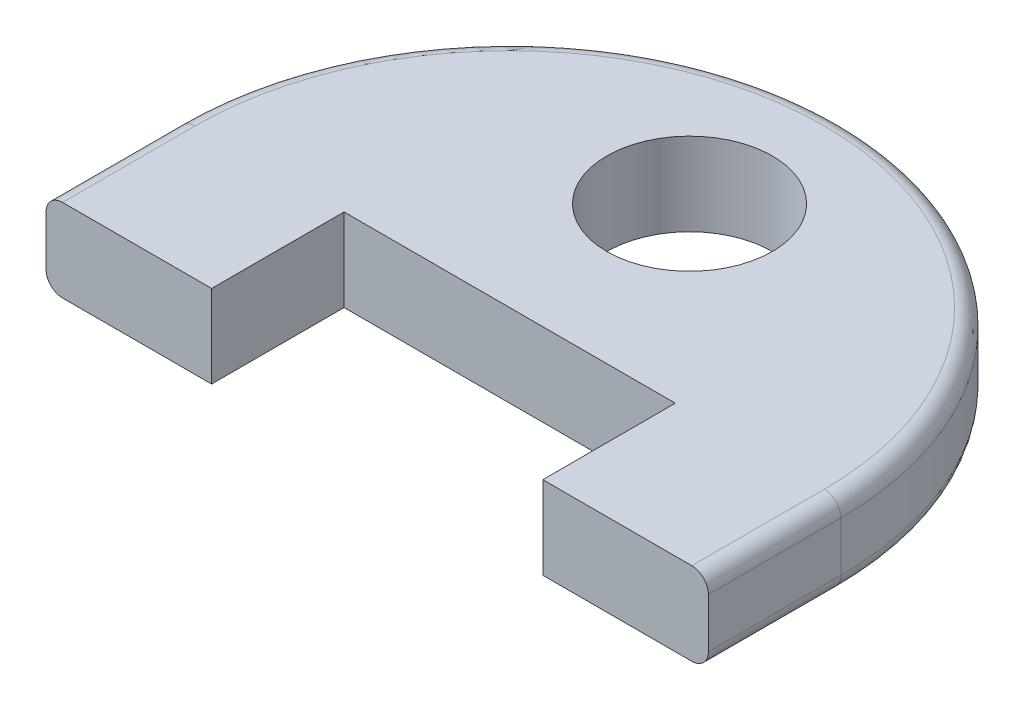
from build123d import *

# Parameters (mm, degrees)
BOSS_EXTRUDE1_DEPTH = 6.35
FILLET2_R           = 1.27
SKETCH2_R           = 6.35
CUT_EXTRUDE1_DEPTH  = 37.477972806


with BuildPart() as part:
    # Sketch1 → Boss-Extrude1 (new body)
    with BuildSketch(Plane(origin=(0, 0, 0), x_dir=(1, 0, 0), z_dir=(0, 1, 0))):
        with BuildLine():
            Line((-25.4, -10.16), (-12.7, -10.16))
            Line((-12.7, -10.16), (-12.7, 0))
            Line((-12.7, 0), (12.7, 0))
            Line((12.7, 0), (12.7, -10.16))
            Line((12.7, -10.16), (25.4, -10.16))
            Line((25.4, -10.16), (25.4, 0))
            ThreePointArc((25.4, 0), (0, 25.4), (-25.4, 0))
            Line((-25.4, 0), (-25.4, -10.16))
        make_face()
    extrude(amount=BOSS_EXTRUDE1_DEPTH)

    # Fillet2
    fillet2_edges = [part.edges().sort_by_distance(p)[0] for p in [
        (25.4, 0, 5.08),
        (-25.4, 0, 5.08),
        (25.4, 6.35, 5.08),
        (-25.4, 6.35, 5.08),
        (0, 0, -25.4),
        (0, 6.35, -25.4),
    ]]
    fillet(fillet2_edges, radius=FILLET2_R)

    # Sketch2 → Cut-Extrude1 (cut, through all)
    with BuildSketch(Plane(origin=(0, 6.35, 0), x_dir=(1, 0, 0), z_dir=(0, 1, 0))):
        with Locations((0, 13.796082309)):
            Circle(SKETCH2_R)
    extrude(amount=-CUT_EXTRUDE1_DEPTH, mode=Mode.SUBTRACT)


solid = part.part
